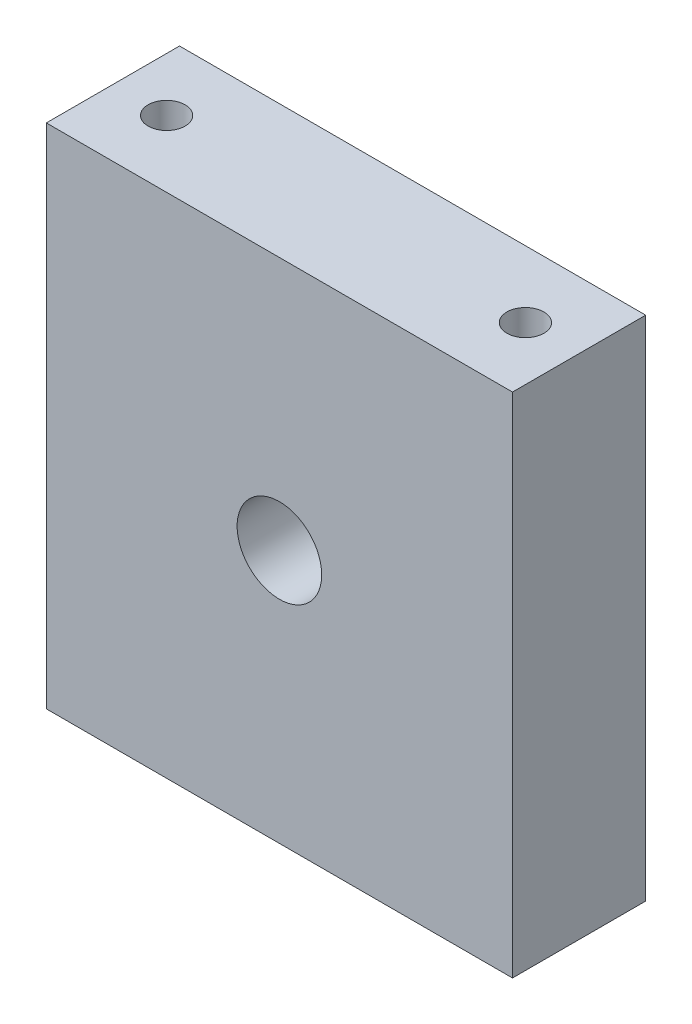
from build123d import *

# Parameters (mm, degrees)
SKETCH1_W                       = 35
SKETCH1_H                       = 38.1
BOSS_EXTRUDE1_DEPTH             = 10
F_7_64_0_10938_DIAMETER_HOLE1_D = 2.778252
SKETCH4_R                       = 3.175
CUT_EXTRUDE1_DEPTH              = 28.733598757


with BuildPart() as part:
    # Sketch1 → Boss-Extrude1 (new body)
    with BuildSketch(Plane.XY):
        Rectangle(SKETCH1_W, SKETCH1_H)
    extrude(amount=BOSS_EXTRUDE1_DEPTH)

    # 7/64 (0.10938) Diameter Hole1 (through all)
    with Locations(Plane(origin=(0, 19.05, 0), x_dir=(1, 0, 0), z_dir=(0, 1, 0))):
        with Locations((-13.47, -5), (13.47, -5)):
            Hole(F_7_64_0_10938_DIAMETER_HOLE1_D / 2)

    # Sketch4 → Cut-Extrude1 (cut, through all)
    with BuildSketch(Plane.XY.offset(10)):
        Circle(SKETCH4_R)
    extrude(amount=-CUT_EXTRUDE1_DEPTH, mode=Mode.SUBTRACT)


solid = part.part
